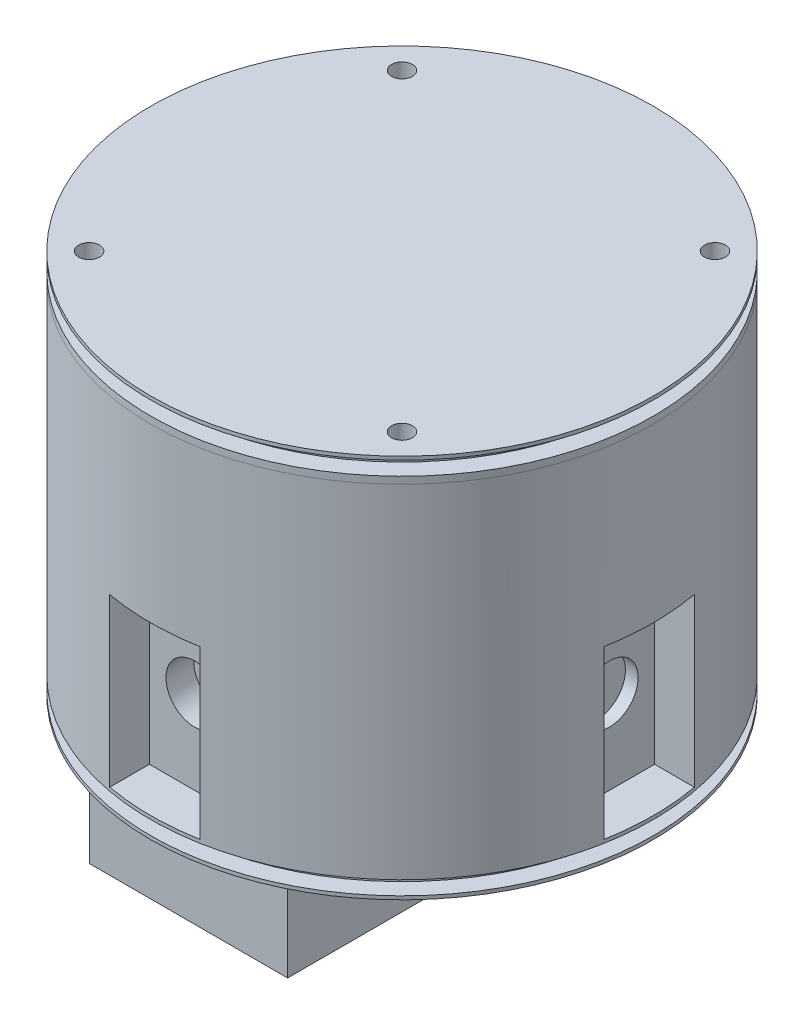
from build123d import *
from OCP.BRepFilletAPI import BRepFilletAPI_MakeFillet

# Parameters (mm, degrees)
EXTRUDE_START            = -2
SKETCH_1_R               = 72.25
EXTRUDE_8_DEPTH          = 99.5
SKETCH_5_W               = 10.5
SKETCH_5_H               = 22
SKETCH_5_W_2             = 22
SKETCH_5_H_2             = 10.5
CUT_EXTRUDE_1_DEPTH      = 48
SKETCH_40_R              = 8.25
CUT_EXTRUDE_2_DEPTH      = 8
PATTERN_CIRCULAR_1_COUNT = 4
SHELL_START              = -49.642711667
SHELL_6_OUTLINE_W        = 30
SHELL_6_OUTLINE_H        = 50
SHELL_6_DEPTH            = 99.285423334
SHELL_START_2            = -57.642711667
SHELL_6_2_OUTLINE_W      = 30
SHELL_6_2_OUTLINE_H      = 50
SHELL_6_2_OUTLINE_R      = 10.25
SHELL_6_2_DEPTH          = 115.285423334
SHELL_6_3_OUTLINE_W      = 50
SHELL_6_3_OUTLINE_H      = 30
SHELL_6_3_DEPTH          = 99.285423334
SHELL_6_4_OUTLINE_W      = 50
SHELL_6_4_OUTLINE_H      = 30
SHELL_6_4_OUTLINE_R      = 10.25
SHELL_6_4_DEPTH          = 115.285423334
SHELL_6_5_DEPTH          = 97.5
SHELL_START_3            = 50
SHELL_6_6_DEPTH          = 47.5
CUT_EXTRUDE_5_DEPTH      = 48
SKETCH_37_W              = 68
SKETCH_37_H              = 1.5
EXTRUDE_9_DEPTH          = 34
EXTRUDE_9_2_DEPTH        = 34
EXTRUDE_9_3_DEPTH        = 34
EXTRUDE_9_4_DEPTH        = 34
EXTRUDE_9_5_DEPTH        = 34
EXTRUDE_10_DEPTH         = 65
EXTRUDE_11_DEPTH         = 55
EXTRUDE_START_2          = -6
SKETCH_1_26_R            = 72.25
EXTRUDE_13_DEPTH         = 6
SKETCH_47_W              = 57
SKETCH_47_H              = 106
EXTRUDE_12_DEPTH         = 34
SKETCH_50_R              = 6
CUT_EXTRUDE_6_DEPTH      = 6
EXTRUDE_START_3          = 91.5
SKETCH_1_36_R            = 72.25
SKETCH_1_36_R_2          = 71
SKETCH_1_36_R_3          = 68
SKETCH_1_36_R_4          = 67
EXTRUDE_19_DEPTH         = 6
CUT_EXTRUDE_START        = 97.5
SKETCH_1_37_R            = 71
SKETCH_1_37_R_2          = 68
CUT_EXTRUDE_11_DEPTH     = 2
EXTRUDE_START_4          = -97.5
EXTRUDE_20_DEPTH         = 6
SKETCH_62_W              = 5
SKETCH_62_H              = 4
SKETCH_63_R              = 1.5
CUT_EXTRUDE_12_DEPTH     = 6
EXTRUDE_START_5          = 97.5
SKETCH_1_39_R            = 72.25
EXTRUDE_22_DEPTH         = 7
SKETCH_64_R              = 3
CUT_EXTRUDE_13_DEPTH     = 6
CUT_EXTRUDE_START_2      = 6
SKETCH_63_2_R            = 1.5
CUT_EXTRUDE_14_DEPTH     = 6
SKETCH_65_R              = 1.5
CUT_EXTRUDE_15_DEPTH     = 6
SKETCH_66_W              = 5
SKETCH_66_H              = 4
SKETCH_1_41_R            = 68
SKETCH_1_41_R_2          = 67
EXTRUDE_24_DEPTH         = 6
SKETCH_61_R              = 1.5
CUT_EXTRUDE_16_DEPTH     = 6
PATTERN_CIRCULAR_2_COUNT = 4
EXTRUDE_27_OUTLINE_W     = 85
EXTRUDE_27_OUTLINE_H     = 80
EXTRUDE_27_OUTLINE_R     = 2
EXTRUDE_27_DEPTH         = 25
SKETCH_71_W              = 85
SKETCH_71_H              = 80
EXTRUDE_28_DEPTH         = 1.8
EXTRUDE_START_6          = 25
EXTRUDE_29_DEPTH         = 1
EXTRUDE_30_OUTLINE_W     = 85
EXTRUDE_30_OUTLINE_H     = 80
EXTRUDE_30_OUTLINE_R     = 2
EXTRUDE_30_DEPTH         = 1.5
FILLET_2_R1              = 3
FILLET_2_R2              = 2
FILLET_3_R               = 3
SKETCH_72_R              = 4
CUT_EXTRUDE_17_DEPTH     = 7
SKETCH_73_W              = 112
SKETCH_73_H              = 62
SKETCH_73_W_2            = 110
SKETCH_73_H_2            = 60
EXTRUDE_2_DEPTH          = 40
SKETCH_73_3_W            = 110
SKETCH_73_3_H            = 60
EXTRUDE_31_DEPTH         = 2
FILLET_4_R               = 1
EXTRUDE_START_7          = 38
SKETCH_74_R              = 2
EXTRUDE_32_DEPTH         = 6


with BuildPart() as part:
    # 草圖1 → 填料-伸長8 (new body)
    with BuildSketch(Plane(origin=(0, 0, 0), x_dir=(1, 0, 0), z_dir=(0, 1, 0)).offset(EXTRUDE_START)):
        with Locations(Location((0, 0, 0), (0, 0, 270))):
            Circle(SKETCH_1_R)
    extrude(amount=EXTRUDE_8_DEPTH)

    # 草圖5 → 除料-伸長1 (cut)
    with BuildSketch(Plane(origin=(0, 0, 0), x_dir=(1, 0, 0), z_dir=(0, 1, 0))):
        with Locations((64.892711667, 0)):
            Rectangle(SKETCH_5_W, SKETCH_5_H)
        with BuildLine():
            ThreePointArc((72.25, 0), (71.954602966, 6.526684613), (71.070827348, 13))
            Line((71.070827348, 13), (59.642711667, 13))
            Line((59.642711667, 13), (59.642711667, 11))
            Line((59.642711667, 11), (70.142711667, 11))
            Line((70.142711667, 11), (70.142711667, -11))
            Line((70.142711667, -11), (59.642711667, -11))
            Line((59.642711667, -11), (59.642711667, -13))
            Line((59.642711667, -13), (71.070827348, -13))
            ThreePointArc((71.070827348, -13), (71.954602966, -6.526684613), (72.25, 0))
        make_face()
        with Locations((0, 64.892711667)):
            Rectangle(SKETCH_5_W_2, SKETCH_5_H_2)
        with BuildLine():
            ThreePointArc((13, 71.070827348), (0, 72.25), (-13, 71.070827348))
            Line((-13, 71.070827348), (-13, 59.642711667))
            Line((-13, 59.642711667), (-11, 59.642711667))
            Line((-11, 59.642711667), (-11, 70.142711667))
            Line((-11, 70.142711667), (11, 70.142711667))
            Line((11, 70.142711667), (11, 59.642711667))
            Line((11, 59.642711667), (13, 59.642711667))
            Line((13, 59.642711667), (13, 71.070827348))
        make_face()
        with Locations((-64.892711667, 0)):
            Rectangle(SKETCH_5_W, SKETCH_5_H)
        with BuildLine():
            Line((-70.142711667, -11), (-70.142711667, 11))
            Line((-70.142711667, 11), (-59.642711667, 11))
            Line((-59.642711667, 11), (-59.642711667, 13))
            Line((-59.642711667, 13), (-71.070827348, 13))
            ThreePointArc((-71.070827348, 13), (-72.25, 0), (-71.070827348, -13))
            Line((-71.070827348, -13), (-59.642711667, -13))
            Line((-59.642711667, -13), (-59.642711667, -11))
            Line((-59.642711667, -11), (-70.142711667, -11))
        make_face()
        with Locations((0, -64.892711667)):
            Rectangle(SKETCH_5_W_2, SKETCH_5_H_2)
        with BuildLine():
            Line((-13, -59.642711667), (-13, -71.070827348))
            ThreePointArc((-13, -71.070827348), (0, -72.25), (13, -71.070827348))
            Line((13, -71.070827348), (13, -59.642711667))
            Line((13, -59.642711667), (11, -59.642711667))
            Line((11, -59.642711667), (11, -70.142711667))
            Line((11, -70.142711667), (-11, -70.142711667))
            Line((-11, -70.142711667), (-11, -59.642711667))
            Line((-11, -59.642711667), (-13, -59.642711667))
        make_face()
    extrude(amount=CUT_EXTRUDE_1_DEPTH, mode=Mode.SUBTRACT)

    # 草圖40 → 除料-伸長2 (cut)
    with BuildSketch(Plane(origin=(0, 0, -59.642711667), x_dir=(-1, 0, 0), z_dir=(0, 0, -1))):
        with Locations((0, 24)):
            Circle(SKETCH_40_R)
    cut_extrude_2 = extrude(amount=-CUT_EXTRUDE_2_DEPTH, mode=Mode.SUBTRACT)

    # 環狀複製排列1: 除料-伸長2 ×4 about axis
    pattern_circular_1_axis = Axis((0, 0, 0), (0, 1, 0))
    for i in range(1, PATTERN_CIRCULAR_1_COUNT):
        add(cut_extrude_2.rotate(pattern_circular_1_axis, i * 360 / PATTERN_CIRCULAR_1_COUNT), mode=Mode.SUBTRACT)

    # 薄殼6: read off the stored shape, not the designer's step
    # 薄殼6 outline → 薄殼6 (cut)
    with BuildSketch(Plane.XY.offset(SHELL_START)):
        with Locations((0, 25)):
            Rectangle(SHELL_6_OUTLINE_W, SHELL_6_OUTLINE_H)
    extrude(amount=SHELL_6_DEPTH, mode=Mode.SUBTRACT)

    # Shell 6 2 outline → Shell 6 2 (cut)
    with BuildSketch(Plane.XY.offset(SHELL_START_2)):
        with Locations((0, 25)):
            Rectangle(SHELL_6_2_OUTLINE_W, SHELL_6_2_OUTLINE_H)
        with Locations((0, 24)):
            Circle(SHELL_6_2_OUTLINE_R, mode=Mode.SUBTRACT)
    extrude(amount=SHELL_6_2_DEPTH, mode=Mode.SUBTRACT)

    # Shell 6 3 outline → Shell 6 3 (cut)
    with BuildSketch(Plane.YZ.offset(SHELL_START)):
        with Locations((25, 0)):
            Rectangle(SHELL_6_3_OUTLINE_W, SHELL_6_3_OUTLINE_H)
    extrude(amount=SHELL_6_3_DEPTH, mode=Mode.SUBTRACT)

    # Shell 6 4 outline → Shell 6 4 (cut)
    with BuildSketch(Plane.YZ.offset(SHELL_START_2)):
        with Locations((25, 0)):
            Rectangle(SHELL_6_4_OUTLINE_W, SHELL_6_4_OUTLINE_H)
        with Locations((24, 0)):
            Circle(SHELL_6_4_OUTLINE_R, mode=Mode.SUBTRACT)
    extrude(amount=SHELL_6_4_DEPTH, mode=Mode.SUBTRACT)

    # Shell 6 5 outline → Shell 6 5 (cut)
    with BuildSketch(Plane(origin=(0, 0, 0), x_dir=(1, 0, 0), z_dir=(0, 1, 0))):
        with BuildLine():
            Line((15, 15), (68.62989509, 15))
            ThreePointArc((68.62989509, 15), (49.674251378, 49.674251378), (15, 68.62989509))
            Line((15, 68.62989509), (15, 15))
        make_face()
        with BuildLine():
            ThreePointArc((15, -68.62989509), (49.674251378, -49.674251378), (68.62989509, -15))
            Line((68.62989509, -15), (15, -15))
            Line((15, -15), (15, -68.62989509))
        make_face()
        with BuildLine():
            Line((-15, 15), (-15, 68.62989509))
            ThreePointArc((-15, 68.62989509), (-49.674251378, 49.674251378), (-68.62989509, 15))
            Line((-68.62989509, 15), (-15, 15))
        make_face()
        with BuildLine():
            ThreePointArc((-68.62989509, -15), (-49.674251378, -49.674251378), (-15, -68.62989509))
            Line((-15, -68.62989509), (-15, -15))
            Line((-15, -15), (-68.62989509, -15))
        make_face()
    extrude(amount=SHELL_6_5_DEPTH, mode=Mode.SUBTRACT)

    # Shell 6 6 outline → Shell 6 6 (cut)
    with BuildSketch(Plane(origin=(0, 0, 0), x_dir=(1, 0, 0), z_dir=(0, 1, 0)).offset(SHELL_START_3)):
        with BuildLine():
            ThreePointArc((68.62989509, -15), (70.25, 0), (68.62989509, 15))
            Line((68.62989509, 15), (15, 15))
            Line((15, 15), (15, 68.62989509))
            ThreePointArc((15, 68.62989509), (0, 70.25), (-15, 68.62989509))
            Line((-15, 68.62989509), (-15, 15))
            Line((-15, 15), (-68.62989509, 15))
            ThreePointArc((-68.62989509, 15), (-70.25, 0), (-68.62989509, -15))
            Line((-68.62989509, -15), (-15, -15))
            Line((-15, -15), (-15, -68.62989509))
            ThreePointArc((-15, -68.62989509), (0, -70.25), (15, -68.62989509))
            Line((15, -68.62989509), (15, -15))
            Line((15, -15), (68.62989509, -15))
        make_face()
    extrude(amount=SHELL_6_6_DEPTH, mode=Mode.SUBTRACT)

    # 草圖43 → 除料-伸長5 (cut)
    with BuildSketch(Plane(origin=(0, 0, 0), x_dir=(1, 0, 0), z_dir=(0, 1, 0))):
        Polygon((15.617248129, 51.642711667), (-24.146545114, 51.642711667), (-51.642711667, 15.617248129), (-51.642711667, -24.146545114), (-15.617248129, -51.642711667), (24.146545114, -51.642711667), (51.642711667, -15.617248129), (51.642711667, 24.146545114), align=None)
    extrude(amount=CUT_EXTRUDE_5_DEPTH, mode=Mode.SUBTRACT)

    # 草圖1<26> → 填料-伸長13 (add)
    with BuildSketch(Plane(origin=(0, 0, 0), x_dir=(1, 0, 0), z_dir=(0, 1, 0)).offset(EXTRUDE_START_2)):
        with Locations(Location((0, 0, 0), (0, 0, 270))):
            Circle(SKETCH_1_26_R)
    extrude(amount=EXTRUDE_13_DEPTH)

    # 草圖50 → 除料-伸長6 (cut)
    with BuildSketch(Plane(origin=(0, 0, 0), x_dir=(1, 0, 0), z_dir=(0, 1, 0))):
        with Locations(Location((18.322761596, 49.972985564, 0), (0, 0, 270))):
            Circle(SKETCH_50_R)
        with Locations(Location((-49.972985564, -18.322761596, 0), (0, 0, 270))):
            Circle(SKETCH_50_R)
    extrude(amount=-CUT_EXTRUDE_6_DEPTH, mode=Mode.SUBTRACT)

    # 草圖1<36> → 填料-伸長19 (add)
    # profile 1 of 3: a face of its own
    with BuildSketch(Plane(origin=(0, 0, 0), x_dir=(1, 0, 0), z_dir=(0, 1, 0)).offset(EXTRUDE_START_3)):
        with Locations(Location((0, 0, 0), (0, 0, 270))):
            Circle(SKETCH_1_36_R)
        Circle(SKETCH_1_36_R_2, mode=Mode.SUBTRACT)
    # profile 2 of 3: a face of its own
    with BuildSketch(Plane(origin=(0, 0, 0), x_dir=(1, 0, 0), z_dir=(0, 1, 0)).offset(EXTRUDE_START_3)):
        Circle(SKETCH_1_36_R_2)
        Circle(SKETCH_1_36_R_3, mode=Mode.SUBTRACT)
    # profile 3 of 3: a face of its own
    with BuildSketch(Plane(origin=(0, 0, 0), x_dir=(1, 0, 0), z_dir=(0, 1, 0)).offset(EXTRUDE_START_3)):
        Circle(SKETCH_1_36_R_3)
        with Locations(Location((0, 0, 0), (0, 0, 270))):
            Circle(SKETCH_1_36_R_4, mode=Mode.SUBTRACT)
    extrude(amount=EXTRUDE_19_DEPTH)

    # 草圖1<37> → 除料-伸長11 (cut)
    with BuildSketch(Plane(origin=(0, 0, 0), x_dir=(1, 0, 0), z_dir=(0, 1, 0)).offset(CUT_EXTRUDE_START)):
        with Locations(Location((0, 0, 0), (0, 0, 270))):
            Circle(SKETCH_1_37_R)
        with Locations(Location((0, 0, 0), (0, 0, 270))):
            Circle(SKETCH_1_37_R_2, mode=Mode.SUBTRACT)
    extrude(amount=-CUT_EXTRUDE_11_DEPTH, mode=Mode.SUBTRACT)

    # 草圖57 → 填料-伸長20 (add)
    with BuildSketch(Plane.XZ.offset(6).offset(EXTRUDE_START_4)):
        with BuildLine():
            Line((-49.280774487, 45.39168719), (-45, 41.110912703))
            Line((-45, 41.110912703), (-41.110912703, 45))
            Line((-41.110912703, 45), (-45.39168719, 49.280774487))
            ThreePointArc((-45.39168719, 49.280774487), (-47.376154339, 47.376154339), (-49.280774487, 45.39168719))
        make_face()
        with BuildLine():
            Line((-45, -41.110912703), (-49.280774487, -45.39168719))
            ThreePointArc((-49.280774487, -45.39168719), (-47.376154339, -47.376154339), (-45.39168719, -49.280774487))
            Line((-45.39168719, -49.280774487), (-41.110912703, -45))
            Line((-41.110912703, -45), (-45, -41.110912703))
        make_face()
        with BuildLine():
            Line((41.110912703, -45), (45.39168719, -49.280774487))
            ThreePointArc((45.39168719, -49.280774487), (47.376154339, -47.376154339), (49.280774487, -45.39168719))
            Line((49.280774487, -45.39168719), (45, -41.110912703))
            Line((45, -41.110912703), (41.110912703, -45))
        make_face()
        with BuildLine():
            ThreePointArc((49.280774487, 45.39168719), (47.376154339, 47.376154339), (45.39168719, 49.280774487))
            Line((45.39168719, 49.280774487), (41.110912703, 45))
            Line((41.110912703, 45), (45, 41.110912703))
            Line((45, 41.110912703), (49.280774487, 45.39168719))
        make_face()
    extrude(amount=-EXTRUDE_20_DEPTH)

    # 草圖62 → 除料-旋轉2 (revolve, cut)
    with BuildSketch(Plane(origin=(0, 0, 0), x_dir=(-0.7071067811865476, 0, 0.7071067811865476), z_dir=(-0.7071067811865476, 0, -0.7071067811865476)), mode=Mode.PRIVATE) as cut_revolve_2_sk:
        with Locations((-69.75, -3)):
            Rectangle(SKETCH_62_W, SKETCH_62_H)
    revolve(cut_revolve_2_sk.sketch.rotate(Axis((0, 0, 0), (0, 1, 0)), 45), axis=Axis((0, 0, 0), (0, 1, 0)), mode=Mode.SUBTRACT)

    # 草圖63 → 除料-伸長12 (cut)
    with BuildSketch(Plane(origin=(0, 97.5, 0), x_dir=(1, 0, 0), z_dir=(0, 1, 0))):
        with Locations(Location((-45, 45, 0), (0, 0, 270))):
            Circle(SKETCH_63_R)
        with Locations(Location((45, 45, 0), (0, 0, 270))):
            Circle(SKETCH_63_R)
        with Locations(Location((45, -45, 0), (0, 0, 270))):
            Circle(SKETCH_63_R)
        with Locations(Location((-45, -45, 0), (0, 0, 270))):
            Circle(SKETCH_63_R)
    extrude(amount=-CUT_EXTRUDE_12_DEPTH, mode=Mode.SUBTRACT)

    # 草圖1<41> → 填料-伸長24 (add)
    with BuildSketch(Plane(origin=(0, 0, 0), x_dir=(1, 0, 0), z_dir=(0, 1, 0)).offset(EXTRUDE_START_3)):
        with Locations(Location((0, 0, 0), (0, 0, 270))):
            Circle(SKETCH_1_41_R)
        Circle(SKETCH_1_41_R_2, mode=Mode.SUBTRACT)
    extrude(amount=EXTRUDE_24_DEPTH)

    # 草圖61 → 除料-伸長16 (cut)
    with BuildSketch(Plane(origin=(0, 0, 0), x_dir=(1, 0, 0), z_dir=(0, 1, 0))):
        with Locations(Location((-42.426406871, 0, 0), (0, 0, 90))):
            Circle(SKETCH_61_R)
    cut_extrude_16 = extrude(amount=-CUT_EXTRUDE_16_DEPTH, mode=Mode.SUBTRACT)

    # 環狀複製排列2: 除料-伸長16 ×4 about axis
    pattern_circular_2_axis = Axis((0, 0, 0), (0, 1, 0))
    for i in range(1, PATTERN_CIRCULAR_2_COUNT):
        add(cut_extrude_16.rotate(pattern_circular_2_axis, i * 360 / PATTERN_CIRCULAR_2_COUNT), mode=Mode.SUBTRACT)


with BuildPart() as body_2:
    # 草圖37 → 填料-伸長9 (new, symmetric)
    with BuildSketch(Plane(origin=(0, 0, 0), x_dir=(-0.7071067811865476, 0, 0.7071067811865476), z_dir=(-0.7071067811865476, 0, -0.7071067811865476))):
        with Locations((0, 48.75)):
            Rectangle(SKETCH_37_W, SKETCH_37_H)
    extrude(amount=EXTRUDE_9_DEPTH, both=True)


with BuildPart() as body_3:
    # 草圖37 → Extrude 9 2 (new, symmetric)
    with BuildSketch(Plane(origin=(0, 0, 0), x_dir=(-0.7071067811865476, 0, 0.7071067811865476), z_dir=(-0.7071067811865476, 0, -0.7071067811865476))):
        Polygon((-34, 33), (-34, 31.5), (-31.5, 31.5), (34, 31.5), (34, 33), align=None)
    extrude(amount=EXTRUDE_9_2_DEPTH, both=True)


with BuildPart() as body_4:
    # 草圖37 → Extrude 9 3 (new, symmetric)
    with BuildSketch(Plane(origin=(0, 0, 0), x_dir=(-0.7071067811865476, 0, 0.7071067811865476), z_dir=(-0.7071067811865476, 0, -0.7071067811865476))):
        Polygon((-34, 16.5), (-34, 15), (34, 15), (34, 16.5), (-31.5, 16.5), align=None)
    extrude(amount=EXTRUDE_9_3_DEPTH, both=True)


with BuildPart() as body_5:
    # 草圖37 → Extrude 9 4 (new, symmetric)
    with BuildSketch(Plane(origin=(0, 0, 0), x_dir=(-0.7071067811865476, 0, 0.7071067811865476), z_dir=(-0.7071067811865476, 0, -0.7071067811865476))):
        with Locations((0, 65.25)):
            Rectangle(SKETCH_37_W, SKETCH_37_H)
    extrude(amount=EXTRUDE_9_4_DEPTH, both=True)


with BuildPart() as body_6:
    # 草圖37 → Extrude 9 5 (new, symmetric)
    with BuildSketch(Plane(origin=(0, 0, 0), x_dir=(-0.7071067811865476, 0, 0.7071067811865476), z_dir=(-0.7071067811865476, 0, -0.7071067811865476))):
        with Locations((0, 81.75)):
            Rectangle(SKETCH_37_W, SKETCH_37_H)
    extrude(amount=EXTRUDE_9_5_DEPTH, both=True)


with BuildPart() as body_7:
    # 草圖41 → 填料-伸長10 (new body)
    with BuildSketch(Plane(origin=(0, 0, 0), x_dir=(1, 0, 0), z_dir=(0, 1, 0))):
        Polygon((48.371425758, -10.597532563), (10.187659574, -48.781298747), (22.915581635, -61.509220808), (61.099347819, -23.325454624), align=None)
    extrude(amount=EXTRUDE_10_DEPTH)


with BuildPart() as body_8:
    # 草圖46 → 填料-伸長11 (new body)
    with BuildSketch(Plane(origin=(0, 0, 0), x_dir=(1, 0, 0), z_dir=(0, 1, 0))):
        Polygon((-21.653402574, -57.008741633), (-22.714062746, -58.069401805), (-58.069401805, -22.714062746), (-57.008741633, -21.653402574), align=None)
    extrude(amount=EXTRUDE_11_DEPTH)


with BuildPart() as body_9:
    # 草圖47 → 填料-伸長12 (new body)
    with BuildSketch(Plane(origin=(0, 0, 0), x_dir=(1, 0, 0), z_dir=(0, 1, 0)).offset(EXTRUDE_START_2)):
        with Locations((-8.402499724, 0)):
            Rectangle(SKETCH_47_W, SKETCH_47_H)
    extrude(amount=-EXTRUDE_12_DEPTH)


with BuildPart() as body_10:
    # 草圖1<39> → 填料-伸長22 (new body)
    with BuildSketch(Plane(origin=(0, 0, 0), x_dir=(1, 0, 0), z_dir=(0, 1, 0)).offset(EXTRUDE_START_5)):
        with Locations(Location((0, 0, 0), (0, 0, 270))):
            Circle(SKETCH_1_39_R)
    extrude(amount=EXTRUDE_22_DEPTH)

    # 草圖64 → 除料-伸長13 (cut)
    with BuildSketch(Plane(origin=(0, 104.5, 0), x_dir=(1, 0, 0), z_dir=(0, 1, 0))):
        with Locations(Location((-45, 45, 0), (0, 0, 270))):
            Circle(SKETCH_64_R)
        with Locations(Location((45, 45, 0), (0, 0, 270))):
            Circle(SKETCH_64_R)
        with Locations(Location((45, -45, 0), (0, 0, 270))):
            Circle(SKETCH_64_R)
        with Locations(Location((-45, -45, 0), (0, 0, 270))):
            Circle(SKETCH_64_R)
    extrude(amount=-CUT_EXTRUDE_13_DEPTH, mode=Mode.SUBTRACT)

    # 草圖63<2> → 除料-伸長14 (cut)
    with BuildSketch(Plane(origin=(0, 97.5, 0), x_dir=(1, 0, 0), z_dir=(0, 1, 0)).offset(CUT_EXTRUDE_START_2)):
        with Locations(Location((-45, 45, 0), (0, 0, 270))):
            Circle(SKETCH_63_2_R)
        with Locations(Location((45, 45, 0), (0, 0, 270))):
            Circle(SKETCH_63_2_R)
        with Locations(Location((45, -45, 0), (0, 0, 270))):
            Circle(SKETCH_63_2_R)
        with Locations(Location((-45, -45, 0), (0, 0, 270))):
            Circle(SKETCH_63_2_R)
    extrude(amount=-CUT_EXTRUDE_14_DEPTH, mode=Mode.SUBTRACT)

    # 草圖65 → 除料-伸長15 (cut)
    with BuildSketch(Plane.XZ.offset(-97.5)):
        with Locations(Location((-42.426406871, 0, 0), (0, 0, 270))):
            Circle(SKETCH_65_R)
        with Locations(Location((0, 42.426406871, 0), (0, 0, 270))):
            Circle(SKETCH_65_R)
        with Locations(Location((42.426406871, 0, 0), (0, 0, 270))):
            Circle(SKETCH_65_R)
        with Locations(Location((0, -42.426406871, 0), (0, 0, 270))):
            Circle(SKETCH_65_R)
    extrude(amount=-CUT_EXTRUDE_15_DEPTH, mode=Mode.SUBTRACT)

    # 草圖66 → 除料-旋轉3 (revolve, cut)
    with BuildSketch(Plane(origin=(0, 0, 0), x_dir=(-0.7071067811865476, 0, 0.7071067811865476), z_dir=(-0.7071067811865476, 0, -0.7071067811865476)), mode=Mode.PRIVATE) as cut_revolve_3_sk:
        with Locations((-69.75, 101.5)):
            Rectangle(SKETCH_66_W, SKETCH_66_H)
    revolve(cut_revolve_3_sk.sketch.rotate(Axis((0, 0, 0), (0, 1, 0)), 45), axis=Axis((0, 0, 0), (0, 1, 0)), mode=Mode.SUBTRACT)


with BuildPart() as body_11:
    # 填料-伸長27: read off the stored shape, not the designer's step
    # 填料-伸長27 outline → 填料-伸長27 (new body)
    with BuildSketch(Plane(origin=(0, 0, 0), x_dir=(1, 0, 0), z_dir=(0, 1, 0))):
        Rectangle(EXTRUDE_27_OUTLINE_W, EXTRUDE_27_OUTLINE_H)
        with Locations((-39, -36.5)):
            Circle(EXTRUDE_27_OUTLINE_R, mode=Mode.SUBTRACT)
        with Locations((39, -36.5)):
            Circle(EXTRUDE_27_OUTLINE_R, mode=Mode.SUBTRACT)
        with Locations((-39, 36.5)):
            Circle(EXTRUDE_27_OUTLINE_R, mode=Mode.SUBTRACT)
        with BuildLine():
            Line((35.5, -36), (35.5, -38))
            Line((35.5, -38), (-35.5, -38))
            Line((-35.5, -38), (-35.5, -36))
            ThreePointArc((-35.5, -36), (-36.378679656, -33.878679656), (-38.5, -33))
            Line((-38.5, -33), (-40.5, -33))
            Line((-40.5, -33), (-40.5, 33))
            Line((-40.5, 33), (-38.5, 33))
            ThreePointArc((-38.5, 33), (-36.378679656, 33.878679656), (-35.5, 36))
            Line((-35.5, 36), (-35.5, 38))
            Line((-35.5, 38), (35.5, 38))
            Line((35.5, 38), (35.5, 36))
            ThreePointArc((35.5, 36), (36.378679656, 33.878679656), (38.5, 33))
            Line((38.5, 33), (40.5, 33))
            Line((40.5, 33), (40.5, -33))
            Line((40.5, -33), (38.5, -33))
            ThreePointArc((38.5, -33), (36.378679656, -33.878679656), (35.5, -36))
        make_face(mode=Mode.SUBTRACT)
        with Locations((39, 36.5)):
            Circle(EXTRUDE_27_OUTLINE_R, mode=Mode.SUBTRACT)
    extrude(amount=EXTRUDE_27_DEPTH)

    # 草圖71 → 填料-伸長28 (add)
    with BuildSketch(Plane(origin=(0, 0, 0), x_dir=(1, 0, 0), z_dir=(0, 1, 0))):
        Rectangle(SKETCH_71_W, SKETCH_71_H)
    extrude(amount=-EXTRUDE_28_DEPTH)

    # 圓角2: one fillet with a radius per group of edges: ONE call of the kernel's fillet builder (fillet() takes one radius for all edges)
    fillet_2_edges_1 = [body_11.edges().sort_by_distance(p)[0] for p in [
        (-42.5, 11.6, -40),
        (42.5, 11.6, -40),
        (-42.5, 11.6, 40),
        (42.5, 11.6, 40),
    ]]
    fillet_2_edges_2 = [body_11.edges().sort_by_distance(p)[0] for p in [
        (42.5, -1.8, 0),
        (0, -1.8, 40),
        (0, -1.8, -40),
        (-42.5, -1.8, 0),
    ]]
    fillet_2 = BRepFilletAPI_MakeFillet(body_11.part.solid().wrapped)
    for e in fillet_2_edges_1:
        fillet_2.Add(FILLET_2_R1, e.wrapped)
    for e in fillet_2_edges_2:
        fillet_2.Add(FILLET_2_R2, e.wrapped)
    add(Compound.cast(fillet_2.Shape()), mode=Mode.REPLACE)

    # 草圖72 → 除料-伸長17 (cut)
    with BuildSketch(Plane.XY.offset(40)):
        with Locations((-31.789343958, 8.073086361)):
            Circle(SKETCH_72_R)
    extrude(amount=-CUT_EXTRUDE_17_DEPTH, mode=Mode.SUBTRACT)


with BuildPart() as body_12:
    # 草圖69<7> → 填料-伸長29 (new body)
    with BuildSketch(Plane(origin=(0, 0, 0), x_dir=(1, 0, 0), z_dir=(0, 1, 0)).offset(EXTRUDE_START_6)):
        with BuildLine():
            Line((35.5, 38), (-35.5, 38))
            Line((-35.5, 38), (-35.5, 36))
            ThreePointArc((-35.5, 36), (-36.378679656, 33.878679656), (-38.5, 33))
            Line((-38.5, 33), (-40.5, 33))
            Line((-40.5, 33), (-40.5, -33))
            Line((-40.5, -33), (-38.5, -33))
            ThreePointArc((-38.5, -33), (-36.378679656, -33.878679656), (-35.5, -36))
            Line((-35.5, -36), (-35.5, -38))
            Line((-35.5, -38), (35.5, -38))
            Line((35.5, -38), (35.5, -36))
            ThreePointArc((35.5, -36), (36.378679656, -33.878679656), (38.5, -33))
            Line((38.5, -33), (40.5, -33))
            Line((40.5, -33), (40.5, 33))
            Line((40.5, 33), (38.5, 33))
            ThreePointArc((38.5, 33), (36.378679656, 33.878679656), (35.5, 36))
            Line((35.5, 36), (35.5, 38))
        make_face()
    extrude(amount=-EXTRUDE_29_DEPTH)

    # 填料-伸長30: read off the stored shape, not the designer's step
    # 填料-伸長30 outline → 填料-伸長30 (add)
    with BuildSketch(Plane(origin=(0, 0, 0), x_dir=(1, 0, 0), z_dir=(0, 1, 0)).offset(EXTRUDE_START_6)):
        Rectangle(EXTRUDE_30_OUTLINE_W, EXTRUDE_30_OUTLINE_H)
        with Locations((-39, -36.5)):
            Circle(EXTRUDE_30_OUTLINE_R, mode=Mode.SUBTRACT)
        with Locations((39, -36.5)):
            Circle(EXTRUDE_30_OUTLINE_R, mode=Mode.SUBTRACT)
        with Locations((-39, 36.5)):
            Circle(EXTRUDE_30_OUTLINE_R, mode=Mode.SUBTRACT)
        with Locations((39, 36.5)):
            Circle(EXTRUDE_30_OUTLINE_R, mode=Mode.SUBTRACT)
    extrude(amount=EXTRUDE_30_DEPTH)

    # 圓角3
    fillet_3_edges = [body_12.edges().sort_by_distance(p)[0] for p in [
        (-42.5, 25.75, 40),
        (42.5, 25.75, 40),
        (42.5, 25.75, -40),
        (-42.5, 25.75, -40),
    ]]
    fillet(fillet_3_edges, radius=FILLET_3_R)


with BuildPart() as body_13:
    # 草圖73 → 伸長-薄件2 (new body)
    with BuildSketch(Plane(origin=(0, 0, 0), x_dir=(1, 0, 0), z_dir=(0, 1, 0))):
        Rectangle(SKETCH_73_W, SKETCH_73_H)
        Rectangle(SKETCH_73_W_2, SKETCH_73_H_2, mode=Mode.SUBTRACT)
    extrude(amount=EXTRUDE_2_DEPTH)

    # 草圖73<3> → 填料-伸長31 (add)
    with BuildSketch(Plane(origin=(0, 0, 0), x_dir=(1, 0, 0), z_dir=(0, 1, 0))):
        Rectangle(SKETCH_73_3_W, SKETCH_73_3_H)
    extrude(amount=EXTRUDE_31_DEPTH)

    # 圓角4
    fillet_4_edges = [body_13.edges().sort_by_distance(p)[0] for p in [
        (56, 20, -31),
        (-56, 20, -31),
        (-56, 20, 31),
        (56, 20, 31),
    ]]
    fillet(fillet_4_edges, radius=FILLET_4_R)

    # 草圖74 → 填料-伸長32 (add)
    # profile 1 of 12: a face of its own
    with BuildSketch(Plane(origin=(0, 2, 0), x_dir=(1, 0, 0), z_dir=(0, 1, 0)).offset(EXTRUDE_START_7)):
        with BuildLine():
            ThreePointArc((-55, 29.949489743), (-56, 27.5), (-55, 25.050510257))
            Line((-55, 25.050510257), (-55, 29.949489743))
        make_face()
    # profile 2 of 12: a face of its own
    with BuildSketch(Plane(origin=(0, 2, 0), x_dir=(1, 0, 0), z_dir=(0, 1, 0)).offset(EXTRUDE_START_7)):
        with BuildLine():
            Line((-54.949489743, 30), (-50.050510257, 30))
            ThreePointArc((-50.050510257, 30), (-52.5, 31), (-54.949489743, 30))
        make_face()
    # profile 3 of 12: a face of its own
    with BuildSketch(Plane(origin=(0, 2, 0), x_dir=(1, 0, 0), z_dir=(0, 1, 0)).offset(EXTRUDE_START_7)):
        with BuildLine():
            ThreePointArc((-55, 25.050510257), (-51.177124344, 24.259629651), (-49, 27.5))
            ThreePointArc((-49, 27.5), (-49.273297806, 28.855873501), (-50.050510257, 30))
            Line((-50.050510257, 30), (-54.949489743, 30))
            ThreePointArc((-54.949489743, 30), (-54.974873734, 29.974873734), (-55, 29.949489743))
            Line((-55, 29.949489743), (-55, 25.050510257))
        make_face()
        with Locations(Location((-52.5, 27.5, 0), (0, 0, 270))):
            Circle(SKETCH_74_R, mode=Mode.SUBTRACT)
    # profile 4 of 12: a face of its own
    with BuildSketch(Plane(origin=(0, 2, 0), x_dir=(1, 0, 0), z_dir=(0, 1, 0)).offset(EXTRUDE_START_7)):
        with BuildLine():
            ThreePointArc((-49, -27.5), (-51.177124344, -24.259629651), (-55, -25.050510257))
            Line((-55, -25.050510257), (-55, -29.949489743))
            ThreePointArc((-55, -29.949489743), (-54.974873734, -29.974873734), (-54.949489743, -30))
            Line((-54.949489743, -30), (-50.050510257, -30))
            ThreePointArc((-50.050510257, -30), (-49.273297806, -28.855873501), (-49, -27.5))
        make_face()
        with Locations(Location((-52.5, -27.5, 0), (0, 0, 270))):
            Circle(SKETCH_74_R, mode=Mode.SUBTRACT)
    # profile 5 of 12: a face of its own
    with BuildSketch(Plane(origin=(0, 2, 0), x_dir=(1, 0, 0), z_dir=(0, 1, 0)).offset(EXTRUDE_START_7)):
        with BuildLine():
            Line((-55, -29.949489743), (-55, -25.050510257))
            ThreePointArc((-55, -25.050510257), (-56, -27.5), (-55, -29.949489743))
        make_face()
    # profile 6 of 12: a face of its own
    with BuildSketch(Plane(origin=(0, 2, 0), x_dir=(1, 0, 0), z_dir=(0, 1, 0)).offset(EXTRUDE_START_7)):
        with BuildLine():
            ThreePointArc((-54.949489743, -30), (-52.5, -31), (-50.050510257, -30))
            Line((-50.050510257, -30), (-54.949489743, -30))
        make_face()
    # profile 7 of 12: a face of its own
    with BuildSketch(Plane(origin=(0, 2, 0), x_dir=(1, 0, 0), z_dir=(0, 1, 0)).offset(EXTRUDE_START_7)):
        with BuildLine():
            Line((54.949489743, -30), (50.050510257, -30))
            ThreePointArc((50.050510257, -30), (52.5, -31), (54.949489743, -30))
        make_face()
    # profile 8 of 12: a face of its own
    with BuildSketch(Plane(origin=(0, 2, 0), x_dir=(1, 0, 0), z_dir=(0, 1, 0)).offset(EXTRUDE_START_7)):
        with BuildLine():
            Line((55, -29.949489743), (55, -25.050510257))
            ThreePointArc((55, -25.050510257), (50.025126266, -25.025126266), (50.050510257, -30))
            Line((50.050510257, -30), (54.949489743, -30))
            ThreePointArc((54.949489743, -30), (54.974873734, -29.974873734), (55, -29.949489743))
        make_face()
        with Locations(Location((52.5, -27.5, 0), (0, 0, 270))):
            Circle(SKETCH_74_R, mode=Mode.SUBTRACT)
    # profile 9 of 12: a face of its own
    with BuildSketch(Plane(origin=(0, 2, 0), x_dir=(1, 0, 0), z_dir=(0, 1, 0)).offset(EXTRUDE_START_7)):
        with BuildLine():
            ThreePointArc((56, -27.5), (55.740370349, -26.177124344), (55, -25.050510257))
            Line((55, -25.050510257), (55, -29.949489743))
            ThreePointArc((55, -29.949489743), (55.740370349, -28.822875656), (56, -27.5))
        make_face()
    # profile 10 of 12: a face of its own
    with BuildSketch(Plane(origin=(0, 2, 0), x_dir=(1, 0, 0), z_dir=(0, 1, 0)).offset(EXTRUDE_START_7)):
        with BuildLine():
            Line((54.949489743, 30), (50.050510257, 30))
            ThreePointArc((50.050510257, 30), (50.025126266, 25.025126266), (55, 25.050510257))
            Line((55, 25.050510257), (55, 29.949489743))
            ThreePointArc((55, 29.949489743), (54.974873734, 29.974873734), (54.949489743, 30))
        make_face()
        with Locations(Location((52.5, 27.5, 0), (0, 0, 270))):
            Circle(SKETCH_74_R, mode=Mode.SUBTRACT)
    # profile 11 of 12: a face of its own
    with BuildSketch(Plane(origin=(0, 2, 0), x_dir=(1, 0, 0), z_dir=(0, 1, 0)).offset(EXTRUDE_START_7)):
        with BuildLine():
            Line((55, 29.949489743), (55, 25.050510257))
            ThreePointArc((55, 25.050510257), (55.740370349, 26.177124344), (56, 27.5))
            ThreePointArc((56, 27.5), (55.740370349, 28.822875656), (55, 29.949489743))
        make_face()
    # profile 12 of 12: a face of its own
    with BuildSketch(Plane(origin=(0, 2, 0), x_dir=(1, 0, 0), z_dir=(0, 1, 0)).offset(EXTRUDE_START_7)):
        with BuildLine():
            ThreePointArc((54.949489743, 30), (52.5, 31), (50.050510257, 30))
            Line((50.050510257, 30), (54.949489743, 30))
        make_face()
    extrude(amount=-EXTRUDE_32_DEPTH)


solid = Compound([part.part, body_2.part, body_3.part, body_4.part, body_5.part, body_6.part, body_7.part, body_8.part, body_9.part, body_10.part, body_11.part, body_12.part, body_13.part])
